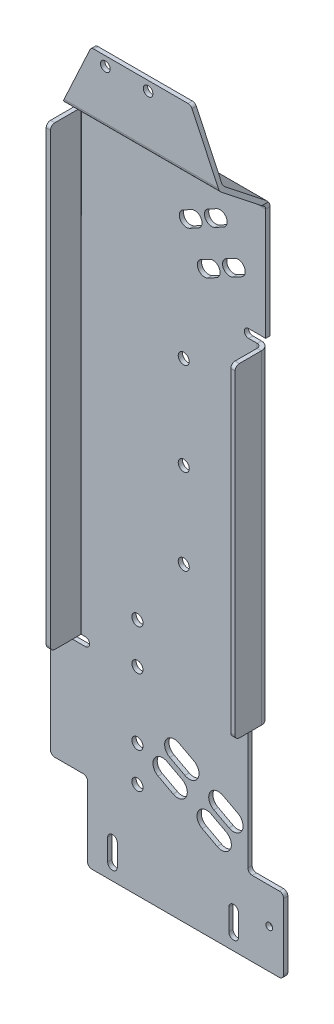
from build123d import *

# Parameters (mm, degrees)
BASE_FLANGE1_DEPTH           = 6
SKETCH23_W                   = 6
SKETCH23_H                   = 265
TAB1_DEPTH                   = 6
EDGE_FLANGE1_START           = -735
EDGE_FLANGE1_DEPTH           = 467
EDGE_FLANGE1_2_DEPTH         = 455
EDGE_FLANGE1_START_2         = -1
EDGE_FLANGE1_3_DEPTH         = 13
CUT_EXTRUDE1_DEPTH           = 10
EDGE_FLANGE2_STRIP_W         = 24.5
EDGE_FLANGE2_STRIP_H         = 6
EDGE_FLANGE2_STRIP_CUT_DEPTH = 646
EDGE_FLANGE2_DEPTH           = 646
SKETCH26_W                   = 6
SKETCH26_H                   = 42.75
CUT_EXTRUDE2_DEPTH           = 10
CUT_EXTRUDE3_START           = -117
CUT_EXTRUDE3_DEPTH           = 6
BASE_FLANGE3_DEPTH           = 259
CUT_EXTRUDE9_DEPTH           = 1056.632985464
CUT_EXTRUDE9_DEPTH_BACK      = 1056.632985464
CUT_EXTRUDE10_DEPTH          = 1056.632985469
CUT_EXTRUDE10_DEPTH_BACK     = 1056.632985469
CUT_EXTRUDE11_DEPTH          = 1056.33170141
CUT_EXTRUDE11_DEPTH_BACK     = 1056.33170141
SKETCH37_R                   = 6.75
SKETCH37_R_2                 = 7.75
SKETCH37_R_3                 = 7.825
SKETCH37_R_4                 = 4.75
FILLET1_R                    = 6
FILLET2_R                    = 6
FILLET3_R                    = 6
CUT_EXTRUDE12_DEPTH          = 1056.33170141
CUT_EXTRUDE12_DEPTH_BACK     = 1056.33170141


with BuildPart() as part:
    # Base-Flange1: sheet metal written as solids
    # Sketch1 → Base-Flange1 (new body)
    with BuildSketch(Plane(origin=(0, 0, 0), x_dir=(0, 1, 0), z_dir=(0, 0, 1))):
        Polygon((-117, 0), (-117, 90), (-769, 90), (-769, 127), (-925, 127), (-925, 75), (-1035, 75), (-1035, 0), (-1035, -200), (-930, -200), (-930, -150), (-735, -150), (-735, -175), (-117, -175), align=None)
    extrude(amount=BASE_FLANGE1_DEPTH)

    # Tab1: sheet metal written as solids
    # Sketch23 → Tab1 (add)
    with BuildSketch(Plane(origin=(0, 0, 0), x_dir=(0, 1, 0), z_dir=(0, 0, 1))):
        with Locations((-114, -42.5)):
            Rectangle(SKETCH23_W, SKETCH23_H)
    extrude(amount=TAB1_DEPTH)

    # Edge-Flange1: read off the stored shape, not the designer's step
    # Edge-Flange1 outline → Edge-Flange1 (cut)
    with BuildSketch(Plane(origin=(0, 0, 0), x_dir=(1, 0, 0), z_dir=(0, 1, 0)).offset(EDGE_FLANGE1_START)):
        with BuildLine():
            ThreePointArc((163, 0), (169, -1.607695155), (173.392304845, -6))
            Line((173.392304845, -6), (175, -6))
            Line((175, -6), (175, 0))
            Line((175, 0), (163, 0))
        make_face()
    extrude(amount=EDGE_FLANGE1_DEPTH, mode=Mode.SUBTRACT)

    # Edge-Flange1 2 outline → Edge-Flange1 2 (add)
    with BuildSketch(Plane(origin=(0, 0, 0), x_dir=(1, 0, 0), z_dir=(0, 1, 0)).offset(EDGE_FLANGE1_START)):
        with BuildLine():
            Line((175, -49), (175, -12))
            ThreePointArc((175, -12), (174.591109915, -8.894171459), (173.392304845, -6))
            Line((173.392304845, -6), (163, -6))
            ThreePointArc((163, -6), (167.242640687, -7.757359313), (169, -12))
            Line((169, -12), (169, -49))
            Line((169, -49), (175, -49))
        make_face()
    extrude(amount=EDGE_FLANGE1_2_DEPTH)

    # Edge-Flange1 3 outline → Edge-Flange1 3 (cut)
    with BuildSketch(Plane.XY.offset(EDGE_FLANGE1_START_2)):
        with BuildLine():
            Line((174, -268), (151, -268))
            ThreePointArc((151, -268), (145, -274), (151, -280))
            Line((151, -280), (174, -280))
            Line((174, -280), (174, -268))
        make_face()
    extrude(amount=EDGE_FLANGE1_3_DEPTH, mode=Mode.SUBTRACT)

    # Sketch11 → Cut-Extrude1 (cut)
    with BuildSketch(Plane.XY.offset(6)):
        with BuildLine():
            Line((-90, -769), (-78, -769))
            ThreePointArc((-78, -769), (-72, -763), (-78, -757))
            Line((-78, -757), (-90, -757))
            Line((-90, -757), (-90, -769))
        make_face()
    extrude(amount=-CUT_EXTRUDE1_DEPTH, mode=Mode.SUBTRACT)

    # Edge-Flange2: sheet metal written as solids
    # Edge-Flange2 strip (on a plane across the edge) → Edge-Flange2 strip cut (cut)
    with BuildSketch(Plane(origin=(-90, -111, 6), x_dir=(1, 0, 0), z_dir=(0, -1, 0))):
        with Locations((-6, -3)):
            Rectangle(EDGE_FLANGE2_STRIP_W, EDGE_FLANGE2_STRIP_H)
    extrude(amount=EDGE_FLANGE2_STRIP_CUT_DEPTH, mode=Mode.SUBTRACT)

    # Edge-Flange2 section (on a plane across the edge) → Edge-Flange2 (add)
    with BuildSketch(Plane(origin=(-90, -111, 6), x_dir=(1, 0, 0), z_dir=(0, -1, 0))):
        with BuildLine():
            Line((0, 0.25), (0, 43))
            Line((0, 43), (6, 43))
            Line((6, 43), (6, 0.25))
            ThreePointArc((6, 0.25), (6.073223305, 0.073223305), (6.25, 0))
            Line((6.25, 0), (6.25, -6))
            ThreePointArc((6.25, -6), (1.830582618, -4.169417382), (0, 0.25))
        make_face()
    extrude(amount=EDGE_FLANGE2_DEPTH)

    # Sketch26 → Cut-Extrude2 (cut)
    with BuildSketch(Plane.YZ.offset(-84)):
        with Locations((-114, 27.625)):
            Rectangle(SKETCH26_W, SKETCH26_H)
    extrude(amount=-CUT_EXTRUDE2_DEPTH, mode=Mode.SUBTRACT)

    # Cut-Extrude3: read off the stored shape, not the designer's step
    # Cut-Extrude3 outline → Cut-Extrude3 (cut)
    with BuildSketch(Plane(origin=(0, 0, 0), x_dir=(1, 0, 0), z_dir=(0, 1, 0)).offset(CUT_EXTRUDE3_START)):
        with BuildLine():
            ThreePointArc((-84, -6.25), (-83.930277563, -6.07679492), (-83.76, -6.00020008))
            Line((-83.76, -6.00020008), (-84, -0.005002002))
            ThreePointArc((-84, -0.005002002), (-88.256939094, -1.919872981), (-90, -6.25))
            Line((-90, -6.25), (-84, -6.25))
        make_face()
    extrude(amount=CUT_EXTRUDE3_DEPTH, mode=Mode.SUBTRACT)


with BuildPart() as body_2:
    # Base-Flange3: sheet metal written as solids
    # Sketch30 → Base-Flange3 (new body)
    with BuildSketch(Plane.YZ.offset(175)):
        with BuildLine():
            Line((-111, 6), (-111, 0.002501001))
            ThreePointArc((-111, 0.002501001), (-105.51905867, 1.327640169), (-101.248871353, 5.010331028))
            Line((-101.248871353, 5.010331028), (-70.795195827, 47.49556302))
            ThreePointArc((-70.795195827, 47.49556302), (-68.659657086, 49.337292297), (-65.918615142, 50))
            Line((-65.918615142, 50), (13, 50))
            Line((13, 50), (13, 56))
            Line((13, 56), (-68.996922843, 56))
            ThreePointArc((-68.996922843, 56), (-71.737964787, 55.337292297), (-73.873503528, 53.49556302))
            Line((-73.873503528, 53.49556302), (-106.123419315, 8.50443698))
            ThreePointArc((-106.123419315, 8.50443698), (-108.258958056, 6.662707703), (-111, 6))
        make_face()
    extrude(amount=-BASE_FLANGE3_DEPTH)


with BuildPart() as cut_extrude9_tool:
    # Sketch35 → Cut-Extrude9 (new, two sides: drawn at the far end of the back side and taken through both)
    with BuildSketch(Plane.XY.offset(56).offset(-CUT_EXTRUDE9_DEPTH_BACK)):
        with BuildLine():
            Line((-20, 13), (-78.533073432, -113.420090629))
            ThreePointArc((-78.533073432, -113.420090629), (-84.999052656, -116.625153199), (-89.52, -111))
            Line((-89.52, -111), (-89.52, 13))
            Line((-89.52, 13), (-20, 13))
        make_face()
    extrude(amount=CUT_EXTRUDE9_DEPTH + CUT_EXTRUDE9_DEPTH_BACK)


with BuildPart() as part_1:
    add(part.part)

    # Cut-Extrude9: cut by cut_extrude9_tool
    add(cut_extrude9_tool.part, mode=Mode.SUBTRACT)


with BuildPart() as body_2_1:
    add(body_2.part)

    # Cut-Extrude9: cut by cut_extrude9_tool
    add(cut_extrude9_tool.part, mode=Mode.SUBTRACT)

    # Sketch36 → Cut-Extrude10 (cut, two sides: drawn at the far end of the back side and taken through both)
    with BuildSketch(Plane.XY.offset(56).offset(-CUT_EXTRUDE10_DEPTH_BACK)):
        Polygon((120, 13), (175, -104), (178.738501247, -104), (178.738501247, 13), align=None)
    extrude(amount=CUT_EXTRUDE10_DEPTH + CUT_EXTRUDE10_DEPTH_BACK, mode=Mode.SUBTRACT)


with BuildPart() as cut_extrude11_tool:
    # Sketch37 → Cut-Extrude11 (new, two sides: drawn at the far end of the back side and taken through both)
    with BuildSketch(Plane.XY.offset(6).offset(-CUT_EXTRUDE11_DEPTH_BACK)):
        Circle(SKETCH37_R)
        with Locations((60, 0)):
            Circle(SKETCH37_R)
        with Locations((60, -350)):
            Circle(SKETCH37_R_2)
        with Locations((60, -480)):
            Circle(SKETCH37_R_2)
        with Locations((60, -600)):
            Circle(SKETCH37_R_2)
        with Locations((140, -350)):
            Circle(SKETCH37_R_2)
        with Locations((140, -480)):
            Circle(SKETCH37_R_2)
        with Locations((140, -600)):
            Circle(SKETCH37_R_2)
        with Locations((-5, -900)):
            Circle(SKETCH37_R_3)
        with Locations((-5, -850)):
            Circle(SKETCH37_R_3)
        with Locations((-5, -757)):
            Circle(SKETCH37_R_3)
        with Locations((-5, -700)):
            Circle(SKETCH37_R_3)
        with Locations((180, -980)):
            Circle(SKETCH37_R_4)
        with BuildLine():
            Line((-33.25, -985), (-33.25, -1015))
            ThreePointArc((-33.25, -1015), (-40, -1021.75), (-46.75, -1015))
            Line((-46.75, -1015), (-46.75, -985))
            ThreePointArc((-46.75, -985), (-40, -978.25), (-33.25, -985))
        make_face()
        with BuildLine():
            Line((136.75, -985), (136.75, -1015))
            ThreePointArc((136.75, -1015), (130, -1021.75), (123.25, -1015))
            Line((123.25, -1015), (123.25, -985))
            ThreePointArc((123.25, -985), (130, -978.25), (136.75, -985))
        make_face()
    extrude(amount=CUT_EXTRUDE11_DEPTH + CUT_EXTRUDE11_DEPTH_BACK)


with BuildPart() as part_2:
    add(part_1.part)

    # Cut-Extrude11: cut by cut_extrude11_tool
    add(cut_extrude11_tool.part, mode=Mode.SUBTRACT)

    # Fillet1
    fillet1_edges = [part_2.edges().sort_by_distance(p)[0] for p in [
        (-75, -1035, 3),
        (-75, -925, 3),
        (-127, -925, 3),
        (-127, -769, 3),
        (150, -735, 3),
        (150, -930, 3),
        (200, -930, 3),
        (200, -1035, 3),
    ]]
    fillet(fillet1_edges, radius=FILLET1_R)

    # Fillet3
    fillet3_edges = [part_2.edges().sort_by_distance(p)[0] for p in [
        (-87, -757, 49),
        (-87, -117, 49),
        (172, -735, 49),
        (172, -280, 49),
    ]]
    fillet(fillet3_edges, radius=FILLET3_R)

    # Sketch38 → Cut-Extrude12 (cut, two sides: drawn at the far end of the back side and taken through both)
    with BuildSketch(Plane.XY.offset(6).offset(-CUT_EXTRUDE12_DEPTH_BACK)):
        with BuildLine():
            Line((84.362168458, -217.568473383), (96.281960962, -211.230607286))
            ThreePointArc((96.281960962, -211.230607286), (109.806152518, -215.365367586), (105.671392218, -228.889559143))
            Line((105.671392218, -228.889559143), (93.751599714, -235.22742524))
            ThreePointArc((93.751599714, -235.22742524), (80.227408158, -231.09266494), (84.362168458, -217.568473383))
        make_face()
        with BuildLine():
            Line((68.400135324, -187.548255226), (80.319927827, -181.210389128))
            ThreePointArc((80.319927827, -181.210389128), (84.454688128, -167.686197572), (70.930496572, -163.551437271))
            Line((70.930496572, -163.551437271), (59.010704068, -169.889303369))
            ThreePointArc((59.010704068, -169.889303369), (54.875943767, -183.413494925), (68.400135324, -187.548255226))
        make_face()
        with BuildLine():
            Line((115.637831542, -162.431526617), (103.718039038, -168.769392714))
            ThreePointArc((103.718039038, -168.769392714), (90.193847482, -164.634632414), (94.328607782, -151.110440857))
            Line((94.328607782, -151.110440857), (106.248400286, -144.77257476))
            ThreePointArc((106.248400286, -144.77257476), (119.772591842, -148.90733506), (115.637831542, -162.431526617))
        make_face()
        with BuildLine():
            Line((131.599864676, -192.451744774), (119.680072173, -198.789610872))
            ThreePointArc((119.680072173, -198.789610872), (115.545311872, -212.313802428), (129.069503428, -216.448562729))
            Line((129.069503428, -216.448562729), (140.989295932, -210.110696631))
            ThreePointArc((140.989295932, -210.110696631), (145.124056233, -196.586505075), (131.599864676, -192.451744774))
        make_face()
        with BuildLine():
            Line((45.138586918, -886.573529435), (23.947844689, -875.306211928))
            ThreePointArc((23.947844689, -875.306211928), (18.365918283, -857.048553326), (36.623576884, -851.46662692))
            Line((36.623576884, -851.46662692), (57.814319113, -862.733944427))
            ThreePointArc((57.814319113, -862.733944427), (63.396245519, -880.991603029), (45.138586918, -886.573529435))
        make_face()
        with BuildLine():
            Line((74.245823811, -831.830778677), (53.055081582, -820.56346117))
            ThreePointArc((53.055081582, -820.56346117), (34.797422981, -826.145387576), (40.379349387, -844.403046178))
            Line((40.379349387, -844.403046178), (61.570091615, -855.670363684))
            ThreePointArc((61.570091615, -855.670363684), (79.827750217, -850.088437279), (74.245823811, -831.830778677))
        make_face()
        with BuildLine():
            Line((85.754176189, -908.169221323), (106.944918418, -919.43653883))
            ThreePointArc((106.944918418, -919.43653883), (125.202577019, -913.854612424), (119.620650613, -895.596953822))
            Line((119.620650613, -895.596953822), (98.429908385, -884.329636316))
            ThreePointArc((98.429908385, -884.329636316), (80.172249783, -889.911562721), (85.754176189, -908.169221323))
        make_face()
        with BuildLine():
            Line((114.861413082, -853.426470565), (136.052155311, -864.693788072))
            ThreePointArc((136.052155311, -864.693788072), (141.634081717, -882.951446674), (123.376423116, -888.53337308))
            Line((123.376423116, -888.53337308), (102.185680887, -877.266055573))
            ThreePointArc((102.185680887, -877.266055573), (96.603754481, -859.008396971), (114.861413082, -853.426470565))
        make_face()
    extrude(amount=CUT_EXTRUDE12_DEPTH + CUT_EXTRUDE12_DEPTH_BACK, mode=Mode.SUBTRACT)


with BuildPart() as body_2_2:
    add(body_2_1.part)

    # Cut-Extrude11: cut by cut_extrude11_tool
    add(cut_extrude11_tool.part, mode=Mode.SUBTRACT)

    # Fillet2
    fillet2_edges = [body_2_2.edges().sort_by_distance(p)[0] for p in [
        (-20, 13, 53),
        (120, 13, 53),
    ]]
    fillet(fillet2_edges, radius=FILLET2_R)


solid = Compound([part_2.part, body_2_2.part])
